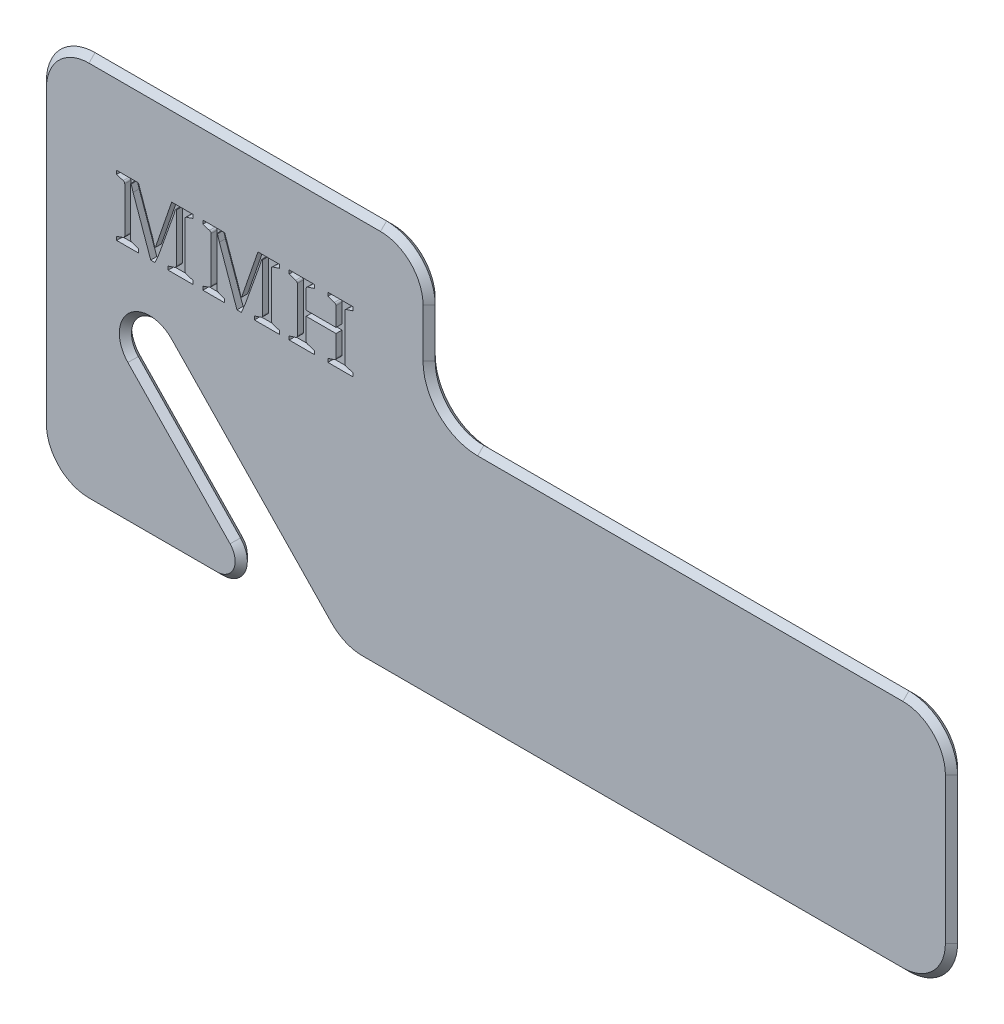
from build123d import *

# Parameters (mm, degrees)
BOSS_EXTRUDE1_DEPTH = 0.635
CUT_EXTRUDE1_DEPTH  = 56.23040037
FILLET1_R           = 2.54
FILLET2_R           = 5.08
CHAMFER1_SIZE       = 0.635
CUT_EXTRUDE2_DEPTH  = 0.635


with BuildPart() as part:
    # Sketch1 → Boss-Extrude1 (new, symmetric)
    with BuildSketch(Plane.XY):
        with BuildLine():
            Line((-6.985, 17.78), (-6.985, 22.86))
            ThreePointArc((-6.985, 22.86), (-8.472897552, 26.452102448), (-12.065, 27.94))
            Line((-12.065, 27.94), (-42.545, 27.94))
            ThreePointArc((-42.545, 27.94), (-46.137102448, 26.452102448), (-47.625, 22.86))
            Line((-47.625, 22.86), (-47.625, -7.62))
            ThreePointArc((-47.625, -7.62), (-46.137102448, -11.212102448), (-42.545, -12.7))
            Line((-42.545, -12.7), (42.545, -12.7))
            ThreePointArc((42.545, -12.7), (46.137102448, -11.212102448), (47.625, -7.62))
            Line((47.625, -7.62), (47.625, 7.62))
            ThreePointArc((47.625, 7.62), (46.137102448, 11.212102448), (42.545, 12.7))
            Line((42.545, 12.7), (-1.905, 12.7))
            ThreePointArc((-1.905, 12.7), (-5.497102448, 14.187897552), (-6.985, 17.78))
        make_face()
    extrude(amount=BOSS_EXTRUDE1_DEPTH, both=True)

    # Sketch2 → Cut-Extrude1 (cut, through all)
    with BuildSketch(Plane.XY.offset(0.635)):
        with BuildLine():
            Line((-34.366873677, 6.208392795), (-16.128022677, -12.7))
            ThreePointArc((-16.128022677, -12.7), (-16.192756205, -16.291519117), (-19.784275323, -16.226785589))
            Line((-19.784275323, -16.226785589), (-38.023126323, 2.681607205))
            ThreePointArc((-38.023126323, 2.681607205), (-37.958392795, 6.273126323), (-34.366873677, 6.208392795))
        make_face()
    extrude(amount=-CUT_EXTRUDE1_DEPTH, mode=Mode.SUBTRACT)

    # Fillet1
    fillet1_edges = [part.edges().sort_by_distance(p)[0] for p in [
        (-23.186178254, -12.7, 0),
    ]]
    fillet(fillet1_edges, radius=FILLET1_R)

    # Fillet2
    fillet2_edges = [part.edges().sort_by_distance(p)[0] for p in [
        (-16.128022677, -12.7, 0),
    ]]
    fillet(fillet2_edges, radius=FILLET2_R)

    # Chamfer1
    chamfer1_edges = [part.edges().sort_by_distance(p)[0] for p in [
        (46.137102448, -11.212102448, -0.635),
        (47.625, 0, -0.635),
        (46.137102448, 11.212102448, -0.635),
        (20.32, 12.7, -0.635),
        (-5.497102448, 14.187897552, -0.635),
        (-6.985, 20.32, -0.635),
        (-8.472897552, 26.452102448, -0.635),
        (-27.305, 27.94, -0.635),
        (-46.137102448, 26.452102448, -0.635),
        (-47.625, 7.62, -0.635),
        (-46.137102448, -11.212102448, -0.635),
        (-35.855157616, -12.7, -0.635),
        (-26.82751523, -11.153121921, -0.635),
        (-32.680157616, -2.8575, -0.635),
        (-37.958392795, 6.273126323, -0.635),
        (-25.996555902, -2.469196397, -0.635),
        (-15.956229324, -12.295600004, -0.635),
        (14.287507259, -12.7, -0.635),
        (-6.985, 20.32, 0.635),
        (-8.472897552, 26.452102448, 0.635),
        (-5.497102448, 14.187897552, 0.635),
        (-27.305, 27.94, 0.635),
        (20.32, 12.7, 0.635),
        (-46.137102448, 26.452102448, 0.635),
        (46.137102448, 11.212102448, 0.635),
        (-47.625, 7.62, 0.635),
        (47.625, 0, 0.635),
        (-46.137102448, -11.212102448, 0.635),
        (46.137102448, -11.212102448, 0.635),
        (-35.855157616, -12.7, 0.635),
        (14.287507259, -12.7, 0.635),
        (-26.82751523, -11.153121921, 0.635),
        (-15.956229324, -12.295600004, 0.635),
        (-32.680157616, -2.8575, 0.635),
        (-37.958392795, 6.273126323, 0.635),
        (-25.996555902, -2.469196397, 0.635),
    ]]
    chamfer(chamfer1_edges, length=CHAMFER1_SIZE - 0.0001)  # a hair under: the kernel refuses the full size

    # Sketch3 → Cut-Extrude2 (cut)
    with BuildSketch(Plane.XY.offset(0.635)):
        with BuildLine():
            Line((-39.65270154, 13.068115942), (-38.972549819, 13.312567935))
            add(Edge.make_bspline(
                [(-38.972549819, 13.312567935), (-38.950442668, 13.321126901), (-38.906600715, 13.338100676), (-38.850139226, 13.38191299), (-38.80788454, 13.4466475), (-38.805560194, 13.498771816), (-38.80430933, 13.526822917)],
                knots=[0, 0, 0, 0, 0.962675957, 1.909137686, 2.874786402, 4, 4, 4, 4], degree=3))
            Line((-38.80430933, 13.526822917), (-38.80430933, 18.249060236))
            add(Edge.make_bspline(
                [(-38.80430933, 18.249060236), (-38.805558824, 18.276639926), (-38.807880675, 18.327889394), (-38.850214572, 18.391324247), (-38.907056345, 18.433314771), (-38.950503377, 18.450354728), (-38.972549819, 18.459001359)],
                knots=[0, 0, 0, 0, 1.1192635, 2.079851469, 3.025653962, 4, 4, 4, 4], degree=3))
            Line((-38.972549819, 18.459001359), (-39.65270154, 18.681884058))
            Line((-39.65270154, 18.681884058), (-39.65270154, 19.05))
            Line((-39.65270154, 19.05), (-37.377860054, 19.05))
            Line((-37.377860054, 19.05), (-35.898206522, 14.856929348))
            Line((-35.898206522, 14.856929348), (-35.676761775, 14.086186594))
            Line((-35.676761775, 14.086186594), (-35.606302083, 14.086186594))
            Line((-35.606302083, 14.086186594), (-33.896576087, 19.05))
            Line((-33.896576087, 19.05), (-31.653369565, 19.05))
            Line((-31.653369565, 19.05), (-31.653369565, 18.681884058))
            Line((-31.653369565, 18.681884058), (-32.324893569, 18.459001359))
            add(Edge.make_bspline(
                [(-32.324893569, 18.459001359), (-32.34742266, 18.450368554), (-32.392409094, 18.433130439), (-32.450880512, 18.390446603), (-32.495095715, 18.327249053), (-32.49850905, 18.276201009), (-32.500323822, 18.249060236)],
                knots=[0, 0, 0, 0, 0.978807922, 1.954498614, 2.9124659, 4, 4, 4, 4], degree=3))
            Line((-32.500323822, 18.249060236), (-32.500323822, 13.500939764))
            add(Edge.make_bspline(
                [(-32.500323822, 13.500939764), (-32.499046154, 13.47204425), (-32.496719623, 13.419427877), (-32.456515124, 13.352096099), (-32.395394966, 13.310015849), (-32.349291102, 13.291937656), (-32.324893569, 13.282370924)],
                knots=[0, 0, 0, 0, 1.125285543, 2.049053076, 2.967585658, 4, 4, 4, 4], degree=3))
            Line((-32.324893569, 13.282370924), (-31.653369565, 13.068115942))
            Line((-31.653369565, 13.068115942), (-31.653369565, 12.7))
            Line((-31.653369565, 12.7), (-34.267567935, 12.7))
            Line((-34.267567935, 12.7), (-34.267567935, 13.068115942))
            Line((-34.267567935, 13.068115942), (-33.596043931, 13.283808877))
            add(Edge.make_bspline(
                [(-33.596043931, 13.283808877), (-33.572470074, 13.292230962), (-33.526590062, 13.308622229), (-33.467029733, 13.353353191), (-33.424323531, 13.420798979), (-33.420972534, 13.474839222), (-33.419175725, 13.50381567)],
                knots=[0, 0, 0, 0, 0.978778438, 1.904922283, 2.876616586, 4, 4, 4, 4], degree=3))
            Line((-33.419175725, 13.50381567), (-33.419175725, 18.566847826))
            Line((-33.419175725, 18.566847826), (-33.504014946, 18.566847826))
            Line((-33.504014946, 18.566847826), (-33.711080163, 17.911141304))
            Line((-33.711080163, 17.911141304), (-35.218054801, 13.683559783))
            Line((-35.218054801, 13.683559783), (-35.637937047, 12.7))
            Line((-35.637937047, 12.7), (-36.088016304, 12.7))
            Line((-36.088016304, 12.7), (-37.930033967, 17.906827446))
            Line((-37.930033967, 17.906827446), (-38.132785326, 18.566847826))
            Line((-38.132785326, 18.566847826), (-38.203245018, 18.566847826))
            Line((-38.203245018, 18.566847826), (-38.203245018, 13.529698822))
            add(Edge.make_bspline(
                [(-38.203245018, 13.529698822), (-38.20188869, 13.501287777), (-38.19943181, 13.449823458), (-38.160677859, 13.3842223), (-38.103243567, 13.341905174), (-38.059430608, 13.323606814), (-38.036442482, 13.314005888)],
                knots=[0, 0, 0, 0, 1.142634983, 2.069791146, 2.987242923, 4, 4, 4, 4], degree=3))
            Line((-38.036442482, 13.314005888), (-37.369232337, 13.068115942))
            Line((-37.369232337, 13.068115942), (-37.369232337, 12.7))
            Line((-37.369232337, 12.7), (-39.65270154, 12.7))
            Line((-39.65270154, 12.7), (-39.65270154, 13.068115942))
        make_face()
        with BuildLine():
            Line((-30.63386096, 13.068115942), (-29.953709239, 13.312567935))
            add(Edge.make_bspline(
                [(-29.953709239, 13.312567935), (-29.931602088, 13.321126901), (-29.887760135, 13.338100676), (-29.831298647, 13.38191299), (-29.78904396, 13.4466475), (-29.786719614, 13.498771816), (-29.78546875, 13.526822917)],
                knots=[0, 0, 0, 0, 0.962675957, 1.909137686, 2.874786402, 4, 4, 4, 4], degree=3))
            Line((-29.78546875, 13.526822917), (-29.78546875, 18.249060236))
            add(Edge.make_bspline(
                [(-29.78546875, 18.249060236), (-29.786718244, 18.276639926), (-29.789040095, 18.327889394), (-29.831373992, 18.391324247), (-29.888215765, 18.433314771), (-29.931662797, 18.450354728), (-29.953709239, 18.459001359)],
                knots=[0, 0, 0, 0, 1.1192635, 2.079851469, 3.025653962, 4, 4, 4, 4], degree=3))
            Line((-29.953709239, 18.459001359), (-30.63386096, 18.681884058))
            Line((-30.63386096, 18.681884058), (-30.63386096, 19.05))
            Line((-30.63386096, 19.05), (-28.359019475, 19.05))
            Line((-28.359019475, 19.05), (-26.879365942, 14.856929348))
            Line((-26.879365942, 14.856929348), (-26.657921196, 14.086186594))
            Line((-26.657921196, 14.086186594), (-26.587461504, 14.086186594))
            Line((-26.587461504, 14.086186594), (-24.877735507, 19.05))
            Line((-24.877735507, 19.05), (-22.634528986, 19.05))
            Line((-22.634528986, 19.05), (-22.634528986, 18.681884058))
            Line((-22.634528986, 18.681884058), (-23.306052989, 18.459001359))
            add(Edge.make_bspline(
                [(-23.306052989, 18.459001359), (-23.32858208, 18.450368554), (-23.373568514, 18.433130439), (-23.432039933, 18.390446603), (-23.476255135, 18.327249053), (-23.479668471, 18.276201009), (-23.481483243, 18.249060236)],
                knots=[0, 0, 0, 0, 0.978807922, 1.954498614, 2.9124659, 4, 4, 4, 4], degree=3))
            Line((-23.481483243, 18.249060236), (-23.481483243, 13.500939764))
            add(Edge.make_bspline(
                [(-23.481483243, 13.500939764), (-23.480205574, 13.47204425), (-23.477879043, 13.419427877), (-23.437674545, 13.352096099), (-23.376554387, 13.310015849), (-23.330450522, 13.291937656), (-23.306052989, 13.282370924)],
                knots=[0, 0, 0, 0, 1.125285543, 2.049053076, 2.967585658, 4, 4, 4, 4], degree=3))
            Line((-23.306052989, 13.282370924), (-22.634528986, 13.068115942))
            Line((-22.634528986, 13.068115942), (-22.634528986, 12.7))
            Line((-22.634528986, 12.7), (-25.248727355, 12.7))
            Line((-25.248727355, 12.7), (-25.248727355, 13.068115942))
            Line((-25.248727355, 13.068115942), (-24.577203351, 13.283808877))
            add(Edge.make_bspline(
                [(-24.577203351, 13.283808877), (-24.553629494, 13.292230962), (-24.507749483, 13.308622229), (-24.448189153, 13.353353191), (-24.405482952, 13.420798979), (-24.402131954, 13.474839222), (-24.400335145, 13.50381567)],
                knots=[0, 0, 0, 0, 0.978778438, 1.904922283, 2.876616586, 4, 4, 4, 4], degree=3))
            Line((-24.400335145, 13.50381567), (-24.400335145, 18.566847826))
            Line((-24.400335145, 18.566847826), (-24.485174366, 18.566847826))
            Line((-24.485174366, 18.566847826), (-24.692239583, 17.911141304))
            Line((-24.692239583, 17.911141304), (-26.199214221, 13.683559783))
            Line((-26.199214221, 13.683559783), (-26.619096467, 12.7))
            Line((-26.619096467, 12.7), (-27.069175725, 12.7))
            Line((-27.069175725, 12.7), (-28.911193388, 17.906827446))
            Line((-28.911193388, 17.906827446), (-29.113944746, 18.566847826))
            Line((-29.113944746, 18.566847826), (-29.184404438, 18.566847826))
            Line((-29.184404438, 18.566847826), (-29.184404438, 13.529698822))
            add(Edge.make_bspline(
                [(-29.184404438, 13.529698822), (-29.18304811, 13.501287777), (-29.18059123, 13.449823458), (-29.14183728, 13.3842223), (-29.084402988, 13.341905174), (-29.040590028, 13.323606814), (-29.017601902, 13.314005888)],
                knots=[0, 0, 0, 0, 1.142634983, 2.069791146, 2.987242923, 4, 4, 4, 4], degree=3))
            Line((-29.017601902, 13.314005888), (-28.350391757, 13.068115942))
            Line((-28.350391757, 13.068115942), (-28.350391757, 12.7))
            Line((-28.350391757, 12.7), (-30.63386096, 12.7))
            Line((-30.63386096, 12.7), (-30.63386096, 13.068115942))
        make_face()
        with BuildLine():
            Line((-21.61502038, 13.068115942), (-20.934868659, 13.282370924))
            add(Edge.make_bspline(
                [(-20.934868659, 13.282370924), (-20.912777158, 13.290939008), (-20.868966239, 13.307930864), (-20.811944595, 13.351861777), (-20.770043874, 13.418506272), (-20.767829207, 13.471954317), (-20.76662817, 13.500939764)],
                knots=[0, 0, 0, 0, 0.949523423, 1.883054144, 2.851957593, 4, 4, 4, 4], degree=3))
            Line((-20.76662817, 13.500939764), (-20.76662817, 18.249060236))
            add(Edge.make_bspline(
                [(-20.76662817, 18.249060236), (-20.767877665, 18.276639926), (-20.770199515, 18.327889394), (-20.812533412, 18.391324247), (-20.869375186, 18.433314771), (-20.912822217, 18.450354728), (-20.934868659, 18.459001359)],
                knots=[0, 0, 0, 0, 1.1192635, 2.079851469, 3.025653962, 4, 4, 4, 4], degree=3))
            Line((-20.934868659, 18.459001359), (-21.61502038, 18.681884058))
            Line((-21.61502038, 18.681884058), (-21.61502038, 19.05))
            Line((-21.61502038, 19.05), (-18.990756341, 19.05))
            Line((-18.990756341, 19.05), (-18.990756341, 18.681884058))
            Line((-18.990756341, 18.681884058), (-19.666594203, 18.461877264))
            add(Edge.make_bspline(
                [(-19.666594203, 18.461877264), (-19.689173518, 18.453322546), (-19.733901769, 18.436376169), (-19.790858105, 18.393317464), (-19.833701014, 18.33131262), (-19.837251413, 18.281453834), (-19.839148551, 18.254812047)],
                knots=[0, 0, 0, 0, 0.994169292, 1.969388891, 2.914953382, 4, 4, 4, 4], degree=3))
            Line((-19.839148551, 18.254812047), (-19.839148551, 16.289130435))
            Line((-19.839148551, 16.289130435), (-16.720228714, 16.289130435))
            Line((-16.720228714, 16.289130435), (-16.720228714, 18.254812047))
            add(Edge.make_bspline(
                [(-16.720228714, 18.254812047), (-16.721347136, 18.282012163), (-16.723408776, 18.332151402), (-16.767270258, 18.393486186), (-16.826032813, 18.436027016), (-16.872559685, 18.452951611), (-16.89709692, 18.461877264)],
                knots=[0, 0, 0, 0, 1.082972327, 1.996293305, 2.943289757, 4, 4, 4, 4], degree=3))
            Line((-16.89709692, 18.461877264), (-17.568620924, 18.681884058))
            Line((-17.568620924, 18.681884058), (-17.568620924, 19.05))
            Line((-17.568620924, 19.05), (-14.944356884, 19.05))
            Line((-14.944356884, 19.05), (-14.944356884, 18.681884058))
            Line((-14.944356884, 18.681884058), (-15.615880888, 18.459001359))
            add(Edge.make_bspline(
                [(-15.615880888, 18.459001359), (-15.640394625, 18.450621127), (-15.687668795, 18.434460047), (-15.747863614, 18.39114694), (-15.788559489, 18.326390725), (-15.79128625, 18.276060974), (-15.792749094, 18.249060236)],
                knots=[0, 0, 0, 0, 1.038348009, 2.002429933, 2.928350194, 4, 4, 4, 4], degree=3))
            Line((-15.792749094, 18.249060236), (-15.792749094, 13.500939764))
            add(Edge.make_bspline(
                [(-15.792749094, 13.500939764), (-15.790909949, 13.472009513), (-15.787522344, 13.41872158), (-15.745949291, 13.350829389), (-15.685436015, 13.307627242), (-15.639367035, 13.290899031), (-15.615880888, 13.282370924)],
                knots=[0, 0, 0, 0, 1.126446775, 2.07485303, 3.018552525, 4, 4, 4, 4], degree=3))
            Line((-15.615880888, 13.282370924), (-14.944356884, 13.068115942))
            Line((-14.944356884, 13.068115942), (-14.944356884, 12.7))
            Line((-14.944356884, 12.7), (-17.568620924, 12.7))
            Line((-17.568620924, 12.7), (-17.568620924, 13.068115942))
            Line((-17.568620924, 13.068115942), (-16.89709692, 13.282370924))
            add(Edge.make_bspline(
                [(-16.89709692, 13.282370924), (-16.872707141, 13.292495725), (-16.826779718, 13.311561336), (-16.765620516, 13.353843604), (-16.723449299, 13.420382116), (-16.721366877, 13.473400264), (-16.720228714, 13.502377717)],
                knots=[0, 0, 0, 0, 1.03562251, 1.950139528, 2.879633887, 4, 4, 4, 4], degree=3))
            Line((-16.720228714, 13.502377717), (-16.720228714, 15.736956522))
            Line((-16.720228714, 15.736956522), (-19.839148551, 15.736956522))
            Line((-19.839148551, 15.736956522), (-19.839148551, 13.502377717))
            add(Edge.make_bspline(
                [(-19.839148551, 13.502377717), (-19.837254309, 13.473518008), (-19.833808763, 13.421023437), (-19.794052192, 13.353361765), (-19.73339418, 13.312717659), (-19.689402154, 13.292732407), (-19.666594203, 13.282370924)],
                knots=[0, 0, 0, 0, 1.139597588, 2.072879048, 3.000871642, 4, 4, 4, 4], degree=3))
            Line((-19.666594203, 13.282370924), (-18.990756341, 13.068115942))
            Line((-18.990756341, 13.068115942), (-18.990756341, 12.7))
            Line((-18.990756341, 12.7), (-21.61502038, 12.7))
            Line((-21.61502038, 12.7), (-21.61502038, 13.068115942))
        make_face()
    extrude(amount=-CUT_EXTRUDE2_DEPTH, mode=Mode.SUBTRACT)


solid = part.part
